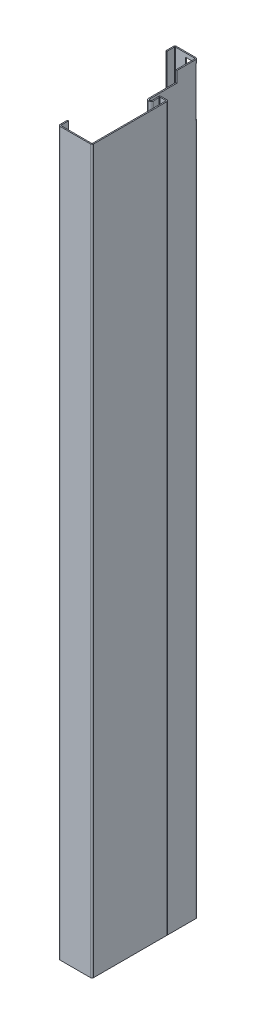
from build123d import *

# Parameters (mm, degrees)
BASE_FLANGE1_DEPTH = 491.5
SKETCH3_W          = 127.454139471
SKETCH3_H          = 14.5
SKETCH3_W_2        = 136.466577612
CUT_EXTRUDE3_DEPTH = 500.481230879
CUT_EXTRUDE5_START = 421.5
CUT_EXTRUDE5_DEPTH = 65


# Read off the part's stored shape, not the designer's step: Cut-Extrude5
# Sheet-metal steps are written as plain solids
with BuildPart() as part:
    # Sketch1 → Base-Flange1 (new, symmetric)
    with BuildSketch(Plane(origin=(0, 0, 0), x_dir=(1, 0, 0), z_dir=(0, 1, 0))):
        with BuildLine():
            Line((9.5, 65), (9.5, 74.7634))
            ThreePointArc((9.5, 74.7634), (10.155084973, 76.344915027), (11.7366, 77))
            Line((11.7366, 77), (37.2634, 77))
            ThreePointArc((37.2634, 77), (38.844915027, 76.344915027), (39.5, 74.7634))
            Line((39.5, 74.7634), (39.5, 30))
            Line((39.5, 30), (39.5, 24))
            Line((39.5, 24), (39.5, 13.8))
            ThreePointArc((39.5, 13.8), (41.269678139, 12.091041686), (42.915834526, 13.91928357))
            Line((42.915834526, 13.91928357), (42.378230266, 21.607382671))
            ThreePointArc((42.378230266, 21.607382671), (42.973636332, 23.288757532), (44.609382021, 24))
            Line((44.609382021, 24), (51.7634, 24))
            ThreePointArc((51.7634, 24), (53.344915027, 23.344915027), (54, 21.7634))
            Line((54, 21.7634), (54, -30))
            Line((54, -30), (54, -74.7634))
            ThreePointArc((54, -74.7634), (53.344915027, -76.344915027), (51.7634, -77))
            Line((51.7634, -77), (39.5, -77))
            Line((39.5, -77), (11.7366, -77))
            ThreePointArc((11.7366, -77), (10.155084973, -76.344915027), (9.5, -74.7634))
            Line((9.5, -74.7634), (9.5, -65))
            Line((9.5, -65), (11, -65))
            Line((11, -65), (11, -74.7634))
            ThreePointArc((11, -74.7634), (11.215745145, -75.284254855), (11.7366, -75.5))
            Line((11.7366, -75.5), (39.5, -75.5))
            Line((39.5, -75.5), (51.7634, -75.5))
            ThreePointArc((51.7634, -75.5), (52.284254855, -75.284254855), (52.5, -74.7634))
            Line((52.5, -74.7634), (52.5, -30))
            Line((52.5, -30), (52.5, 21.7634))
            ThreePointArc((52.5, 21.7634), (52.284254855, 22.284254855), (51.7634, 22.5))
            Line((51.7634, 22.5), (44.609382021, 22.5))
            ThreePointArc((44.609382021, 22.5), (44.070666884, 22.265759992), (43.874576341, 21.712017381))
            Line((43.874576341, 21.712017381), (44.412180601, 14.023918281))
            ThreePointArc((44.412180601, 14.023918281), (41.322027384, 10.591955445), (38, 13.8))
            Line((38, 13.8), (38, 24))
            Line((38, 24), (38, 30))
            Line((38, 30), (38, 74.7634))
            ThreePointArc((38, 74.7634), (37.784254855, 75.284254855), (37.2634, 75.5))
            Line((37.2634, 75.5), (11.7366, 75.5))
            ThreePointArc((11.7366, 75.5), (11.215745145, 75.284254855), (11, 74.7634))
            Line((11, 74.7634), (11, 65))
            Line((11, 65), (9.5, 65))
        make_face()
    extrude(amount=BASE_FLANGE1_DEPTH, both=True)

    # Sketch3 → Cut-Extrude3 (cut, through all)
    with BuildSketch(Plane(origin=(54, 0, 0), x_dir=(0, 0, -1), z_dir=(1, 0, 0))):
        with Locations((-39.227069736, -484.25)):
            Rectangle(SKETCH3_W, SKETCH3_H)
        with Locations((-18.733288806, 484.25)):
            Rectangle(SKETCH3_W_2, SKETCH3_H)
    extrude(amount=-CUT_EXTRUDE3_DEPTH, mode=Mode.SUBTRACT)

    # Cut-Extrude5 outline → Cut-Extrude5 (cut)
    with BuildSketch(Plane(origin=(0, 0, 0), x_dir=(1, 0, 0), z_dir=(0, 1, 0)).offset(CUT_EXTRUDE5_START)):
        with BuildLine():
            Line((37.2634, 77), (24.859115026, 77))
            Line((24.859115026, 77), (24.859115026, 75.5))
            Line((24.859115026, 75.5), (37.2634, 75.5))
            ThreePointArc((37.2634, 75.5), (37.755935518, 75.311111898), (37.995866912, 74.841321649))
            Line((37.995866912, 74.841321649), (39.487450359, 75))
            ThreePointArc((39.487450359, 75), (38.758926663, 76.426463306), (37.2634, 77))
        make_face()
    extrude(amount=CUT_EXTRUDE5_DEPTH, mode=Mode.SUBTRACT)


solid = part.part
